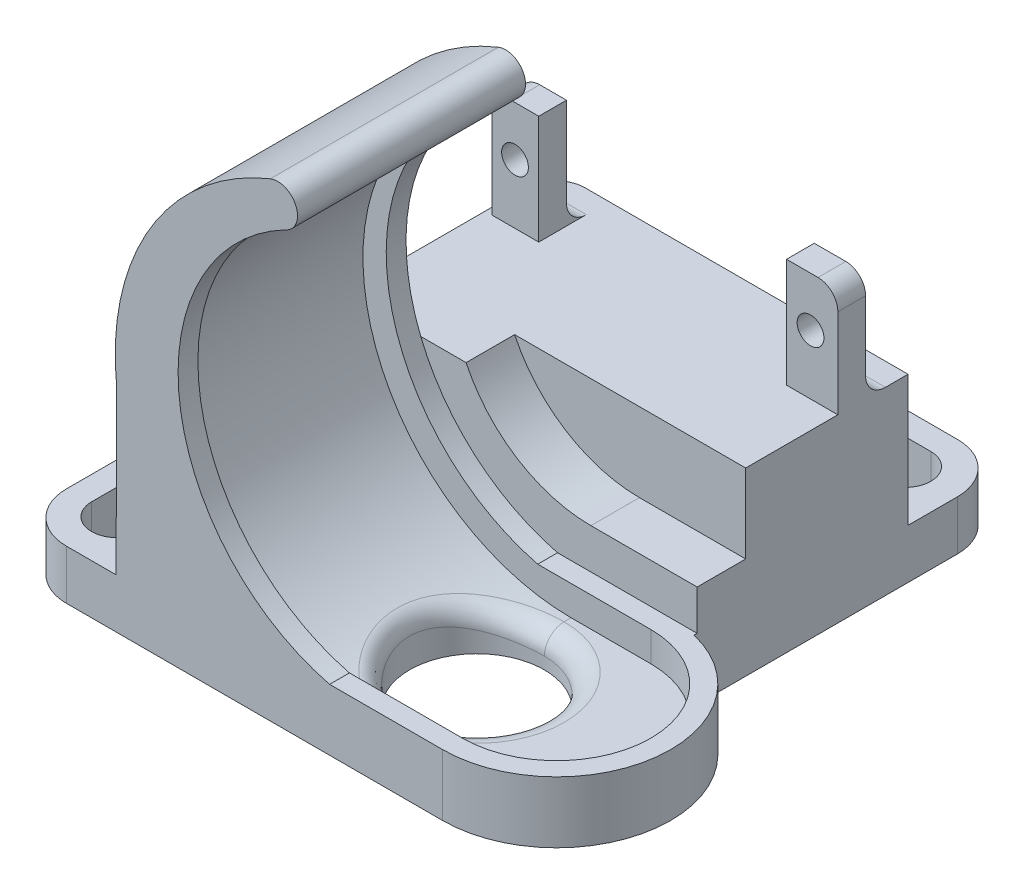
from build123d import *

# Parameters (mm, degrees)
SKETCH1_W                       = 63.5
SKETCH1_H                       = 24.13
BOSS_EXTRUDE1_DEPTH             = 4.064
BOSS_EXTRUDE2_REACH             = 36.207
BOSS_EXTRUDE2_DIRECTION_2_REACH = 36.207
CUT_EXTRUDE1_DEPTH              = 4.064
CUT_EXTRUDE1_DEPTH_BACK         = 66.752974943
SKETCH4_R                       = 8.636
FILLET1_R                       = 2.54
CUT_EXTRUDE2_DEPTH              = 73.348315655
BOSS_EXTRUDE3_DEPTH             = 2.54
BOSS_EXTRUDE4_START             = 2.54
BOSS_EXTRUDE4_DEPTH             = 2.54
BOSS_EXTRUDE5_DEPTH             = 3.81
CUT_EXTRUDE3_DEPTH              = 64.061052508
BOSS_EXTRUDE6_START             = -23.114
SKETCH12_W                      = 44.831
SKETCH12_H                      = 27.027043781
BOSS_EXTRUDE6_DEPTH             = 23.114
BOSS_EXTRUDE7_DEPTH             = 7.874
CUT_EXTRUDE4_START              = -6.219751
CUT_EXTRUDE4_DEPTH              = 6.219751
CUT_EXTRUDE5_DEPTH              = 27.027043781
SKETCH17_W                      = 6.9977
SKETCH17_H                      = 3.556
BOSS_EXTRUDE8_DEPTH             = 13.97
SKETCH18_W                      = 6.389869694
SKETCH18_H                      = 3.556
BOSS_EXTRUDE9_DEPTH             = 13.97
SKETCH19_W                      = 31.75
SKETCH19_H                      = 7.112
CUT_EXTRUDE6_DEPTH              = 13.97
CUT_EXTRUDE7_REACH              = 87.043
SKETCH20_R                      = 1.7145
FILLET2_R                       = 2.54
FILLET3_R                       = 2.54
FILLET4_R                       = 2.54
BOSS_EXTRUDE10_DEPTH            = 29.21
BOSS_EXTRUDE11_DEPTH            = 27.027043781
BOSS_EXTRUDE16_DEPTH            = 6.35
FILLET5_R                       = 6.35
FILLET6_R                       = 3.81


with BuildPart() as part:
    # Sketch1 → Boss-Extrude1 (new body)
    with BuildSketch(Plane(origin=(0, 0, 0), x_dir=(1, 0, 0), z_dir=(0, 1, 0))):
        Rectangle(SKETCH1_W, SKETCH1_H)
    extrude(amount=BOSS_EXTRUDE1_DEPTH)

    # Boss-Extrude2: up to this face of the body (flat: up to its plane)
    boss_extrude2_end = Plane(part.part.faces().sort_by_distance((0, 2.032, 12.065))[0])
    # Sketch2 → Boss-Extrude2 (add, up to the picked face)
    with BuildSketch(Plane.XY, mode=Mode.PRIVATE) as boss_extrude2_sk1:
        with BuildLine():
            Line((0, 4.064), (-26.716755185, 4.064))
            Line((-26.716755185, 4.064), (-31.571041118, 27.367716778))
            ThreePointArc((-31.571041118, 27.367716778), (-27.221246487, 47.076161415), (-11.87173913, 60.180974548))
            ThreePointArc((-11.87173913, 60.180974548), (-8.566242036, 58.774955714), (-9.97226087, 55.46945862))
            ThreePointArc((-9.97226087, 55.46945862), (-26.181898149, 25.654914521), (0, 4.064))
        make_face()
    boss_extrude2_tool1 = split(extrude(boss_extrude2_sk1.sketch, amount=BOSS_EXTRUDE2_REACH, mode=Mode.PRIVATE), bisect_by=boss_extrude2_end, keep=Keep.BOTH, mode=Mode.PRIVATE)
    add(boss_extrude2_tool1.solids().sort_by(Axis((-9.165723, 58.533271, 0), (0, 0, 1)))[0])

    # Boss-Extrude2 direction 2: up to this face of the body (flat: up to its plane)
    boss_extrude2_direction_2_end = Plane(part.part.faces().sort_by_distance((0, 2.032, -12.065))[0])
    # Sketch2 → Boss-Extrude2 direction 2 (add, up to the picked face)
    with BuildSketch(Plane.XY, mode=Mode.PRIVATE) as boss_extrude2_direction_2_sk1:
        with BuildLine():
            Line((0, 4.064), (-26.716755185, 4.064))
            Line((-26.716755185, 4.064), (-31.571041118, 27.367716778))
            ThreePointArc((-31.571041118, 27.367716778), (-27.221246487, 47.076161415), (-11.87173913, 60.180974548))
            ThreePointArc((-11.87173913, 60.180974548), (-8.566242036, 58.774955714), (-9.97226087, 55.46945862))
            ThreePointArc((-9.97226087, 55.46945862), (-26.181898149, 25.654914521), (0, 4.064))
        make_face()
    boss_extrude2_direction_2_tool1 = split(extrude(boss_extrude2_direction_2_sk1.sketch, amount=-BOSS_EXTRUDE2_DIRECTION_2_REACH, mode=Mode.PRIVATE), bisect_by=boss_extrude2_direction_2_end, keep=Keep.BOTH, mode=Mode.PRIVATE)
    add(boss_extrude2_direction_2_tool1.solids().sort_by(Axis((-9.165723, 58.533271, 0), (0, 0, -1)))[0])

    # Sketch4 → Cut-Extrude1 (cut, two sides: drawn at the far end of the back side and taken through both)
    with BuildSketch(Plane(origin=(0, 4.064, 0), x_dir=(1, 0, 0), z_dir=(0, 1, 0)).offset(-CUT_EXTRUDE1_DEPTH_BACK)):
        with Locations(Location((0, 0, 0), (0, 0, 270))):
            Circle(SKETCH4_R)
    extrude(amount=CUT_EXTRUDE1_DEPTH + CUT_EXTRUDE1_DEPTH_BACK, mode=Mode.SUBTRACT)

    # Fillet1
    fillet1_edges = [part.edges().sort_by_distance(p)[0] for p in [
        (-8.636, 5.50091846, 0),
        (8.636, 4.064, 0),
    ]]
    fillet(fillet1_edges, radius=FILLET1_R)

    # Sketch6 → Cut-Extrude2 (cut, through all)
    with BuildSketch(Plane.XY.offset(12.065)):
        Polygon((-31.75, 4.064), (-26.716755185, 4.064), (-25.870202757, 0), (-31.75, 0), align=None)
    extrude(amount=-CUT_EXTRUDE2_DEPTH, mode=Mode.SUBTRACT)

    # Sketch8 → Boss-Extrude3 (add)
    with BuildSketch(Plane.XY.offset(12.065)):
        with BuildLine():
            Line((31.75, 0), (31.75, 7.874))
            Line((31.75, 7.874), (-4.274632474, 7.874))
            ThreePointArc((-4.274632474, 7.874), (-23.508790492, 29.710248048), (-9.97226087, 55.46945862))
            ThreePointArc((-9.97226087, 55.46945862), (-8.566242036, 58.774955714), (-11.87173913, 60.180974548))
            ThreePointArc((-11.87173913, 60.180974548), (-27.221246487, 47.076161415), (-31.571041118, 27.367716778))
            Line((-31.571041118, 27.367716778), (-25.870202757, 0))
            Line((-25.870202757, 0), (31.75, 0))
        make_face()
    extrude(amount=BOSS_EXTRUDE3_DEPTH)

    # Sketch9 → Boss-Extrude4 (add)
    with BuildSketch(Plane(origin=(0, 0, -12.065), x_dir=(-1, 0, 0), z_dir=(0, 0, -1)).offset(BOSS_EXTRUDE4_START)):
        with BuildLine():
            Line((-31.75, 0), (-31.75, 7.874))
            Line((-31.75, 7.874), (4.274632474, 7.874))
            ThreePointArc((4.274632474, 7.874), (23.508790492, 29.710248048), (9.97226087, 55.46945862))
            ThreePointArc((9.97226087, 55.46945862), (8.566242036, 58.774955714), (11.87173913, 60.180974548))
            ThreePointArc((11.87173913, 60.180974548), (27.221246487, 47.076161415), (31.571041118, 27.367716778))
            Line((31.571041118, 27.367716778), (25.870202757, 0))
            Line((25.870202757, 0), (-31.75, 0))
        make_face()
    extrude(amount=-BOSS_EXTRUDE4_DEPTH)

    # Sketch10 → Boss-Extrude5 (add)
    with BuildSketch(Plane(origin=(0, 4.064, 0), x_dir=(1, 0, 0), z_dir=(0, 1, 0))):
        with BuildLine():
            Line((10.218295125, 14.605), (10.218295125, 12.065))
            ThreePointArc((10.218295125, 12.065), (22.283295125, 0), (10.218295125, -12.065))
            Line((10.218295125, -12.065), (10.218295125, -14.605))
            ThreePointArc((10.218295125, -14.605), (24.823295125, 0), (10.218295125, 14.605))
        make_face()
    extrude(amount=BOSS_EXTRUDE5_DEPTH)

    # Sketch11 → Cut-Extrude3 (cut, through all)
    with BuildSketch(Plane(origin=(0, 7.874, 0), x_dir=(1, 0, 0), z_dir=(0, 1, 0))):
        with BuildLine():
            Line((10.218295125, 14.605), (31.75, 14.605))
            Line((31.75, 14.605), (31.75, -14.605))
            Line((31.75, -14.605), (10.218295125, -14.605))
            ThreePointArc((10.218295125, -14.605), (24.823295125, 0), (10.218295125, 14.605))
        make_face()
    extrude(amount=-CUT_EXTRUDE3_DEPTH, mode=Mode.SUBTRACT)

    # Sketch12 → Boss-Extrude6 (add)
    with BuildSketch(Plane.XZ.offset(BOSS_EXTRUDE6_START)):
        with Locations((-8.8011, -28.11852189)):
            Rectangle(SKETCH12_W, SKETCH12_H)
    extrude(amount=BOSS_EXTRUDE6_DEPTH)

    # Sketch13 → Boss-Extrude7 (add)
    with BuildSketch(Plane.XZ):
        Polygon((10.218295125, -14.605), (13.6144, -14.605), (13.6144, -13.335525526), align=None)
    extrude(amount=-BOSS_EXTRUDE7_DEPTH)

    # Sketch14 → Cut-Extrude4 (cut)
    with BuildSketch(Plane.XY.offset(-14.605).offset(CUT_EXTRUDE4_START)):
        with BuildLine():
            Line((0, 13.017313502), (18.620278687, 13.017313502))
            Line((18.620278687, 13.017313502), (17.716686498, 30.734))
            ThreePointArc((17.716686498, 30.734), (-12.527589163, 43.261589163), (0, 13.017313502))
        make_face()
    extrude(amount=CUT_EXTRUDE4_DEPTH, mode=Mode.SUBTRACT)

    # Sketch16 → Cut-Extrude5 (cut)
    with BuildSketch(Plane.XY.offset(-14.605)):
        Polygon((-31.2166, 23.114), (-30.684969694, 23.114), (-25.870202757, 0), (-31.2166, 0), align=None)
    extrude(amount=-CUT_EXTRUDE5_DEPTH, mode=Mode.SUBTRACT)

    # Sketch17 → Boss-Extrude8 (add)
    with BuildSketch(Plane(origin=(0, 23.114, 0), x_dir=(1, 0, 0), z_dir=(0, 1, 0))):
        with Locations((10.11555, 34.413750632)):
            Rectangle(SKETCH17_W, SKETCH17_H)
    extrude(amount=BOSS_EXTRUDE8_DEPTH)

    # Sketch18 → Boss-Extrude9 (add)
    with BuildSketch(Plane(origin=(0, 23.114, 0), x_dir=(1, 0, 0), z_dir=(0, 1, 0))):
        with Locations((-27.490034847, 34.413750632)):
            Rectangle(SKETCH18_W, SKETCH18_H)
    extrude(amount=BOSS_EXTRUDE9_DEPTH)

    # Sketch19 → Cut-Extrude6 (cut)
    with BuildSketch(Plane(origin=(0, 37.084, 0), x_dir=(1, 0, 0), z_dir=(0, 1, 0))):
        with Locations((-8.8392, 36.191750632)):
            Rectangle(SKETCH19_W, SKETCH19_H)
    extrude(amount=-CUT_EXTRUDE6_DEPTH, mode=Mode.SUBTRACT)

    # Sketch20 → Cut-Extrude7 (cut, up to next)
    with BuildSketch(Plane(origin=(0, 0, -36.191750632), x_dir=(-1, 0, 0), z_dir=(0, 0, -1)), mode=Mode.PRIVATE) as cut_extrude7_sk1:
        with Locations((27.75585, 30.734)):
            Circle(SKETCH20_R)
    cut_extrude7_tool1 = extrude(cut_extrude7_sk1.sketch, amount=-CUT_EXTRUDE7_REACH, mode=Mode.PRIVATE) & part.part
    # Sketch20 → Cut-Extrude7 (cut, up to next)
    with BuildSketch(Plane(origin=(0, 0, -36.191750632), x_dir=(-1, 0, 0), z_dir=(0, 0, -1)), mode=Mode.PRIVATE) as cut_extrude7_sk2:
        with Locations((-10.11555, 30.734)):
            Circle(SKETCH20_R)
    cut_extrude7_tool2 = extrude(cut_extrude7_sk2.sketch, amount=-CUT_EXTRUDE7_REACH, mode=Mode.PRIVATE) & part.part
    add(cut_extrude7_tool1.solids().sort_by_distance((-27.75585, 30.734, -36.191751))[0], mode=Mode.SUBTRACT)
    add(cut_extrude7_tool2.solids().sort_by_distance((10.11555, 30.734, -36.191751))[0], mode=Mode.SUBTRACT)

    # Fillet2
    fillet2_edges = [part.edges().sort_by_distance(p)[0] for p in [
        (10.3251, 23.114, -36.191750632),
    ]]
    fillet(fillet2_edges, radius=FILLET2_R)

    # Fillet3
    fillet3_edges = [part.edges().sort_by_distance(p)[0] for p in [
        (-27.699584847, 23.114, -36.191750632),
    ]]
    fillet(fillet3_edges, radius=FILLET3_R)

    # Fillet4
    fillet4_edges = [part.edges().sort_by_distance(p)[0] for p in [
        (13.6144, 37.084, -34.413750632),
        (-30.684969694, 37.084, -34.413750632),
    ]]
    fillet(fillet4_edges, radius=FILLET4_R)

    # Sketch26 → Boss-Extrude10 (add)
    with BuildSketch(Plane.XY.offset(14.605)):
        Polygon((-25.870202757, 0), (-31.653563464, 0), (-31.571041118, 27.367716778), align=None)
    extrude(amount=-BOSS_EXTRUDE10_DEPTH)

    # Sketch22 → Boss-Extrude11 (add)
    with BuildSketch(Plane(origin=(0, 0, -14.605), x_dir=(-1, 0, 0), z_dir=(0, 0, -1))):
        Polygon((30.684969694, 23.114), (31.583867423, 23.114), (31.653563464, 0), (25.870202757, 0), align=None)
    extrude(amount=BOSS_EXTRUDE11_DEPTH)

    # Sketch23 → Boss-Extrude16 (add)
    with BuildSketch(Plane.XZ):
        with BuildLine():
            Line((-15.554631727, 14.605), (-44.353563464, 14.605))
            Line((-44.353563464, 14.605), (-44.353563464, -41.632043781))
            ThreePointArc((-44.353563464, -41.632043781), (-40.609144413, -50.636907459), (-31.583867423, -54.331852538))
            Line((-31.583867423, -54.331852538), (13.6144, -54.332043781))
            Line((13.6144, -54.332043781), (13.6144, -35.10352189))
            Line((13.6144, -35.10352189), (-15.554631727, -35.10352189))
            Line((-15.554631727, -35.10352189), (-15.554631727, 14.605))
        make_face()
        with BuildLine():
            Line((-34.701563464, 8.07647811), (-34.701563464, -35.10352189))
            ThreePointArc((-34.701563464, -35.10352189), (-38.003563464, -38.40552189), (-41.305563464, -35.10352189))
            Line((-41.305563464, -35.10352189), (-41.305563464, 8.07647811))
            ThreePointArc((-41.305563464, 8.07647811), (-38.003563464, 11.37847811), (-34.701563464, 8.07647811))
        make_face(mode=Mode.SUBTRACT)
        with BuildLine():
            Line((-24.859733712, -44.680043781), (6.890266288, -44.680043781))
            ThreePointArc((6.890266288, -44.680043781), (10.192266288, -47.982043781), (6.890266288, -51.284043781))
            Line((6.890266288, -51.284043781), (-24.859733712, -51.284043781))
            ThreePointArc((-24.859733712, -51.284043781), (-28.161733712, -47.982043781), (-24.859733712, -44.680043781))
        make_face(mode=Mode.SUBTRACT)
    extrude(amount=-BOSS_EXTRUDE16_DEPTH)

    # Fillet5
    fillet5_edges = [part.edges().sort_by_distance(p)[0] for p in [
        (13.6144, 3.175, -54.332043781),
        (-44.353563464, 3.175, 14.605),
    ]]
    fillet(fillet5_edges, radius=FILLET5_R)

    # Fillet6
    fillet6_edges = [part.edges().sort_by_distance(p)[0] for p in [
        (-31.609141812, 14.732, -41.632043781),
    ]]
    fillet(fillet6_edges, radius=FILLET6_R)


solid = part.part
